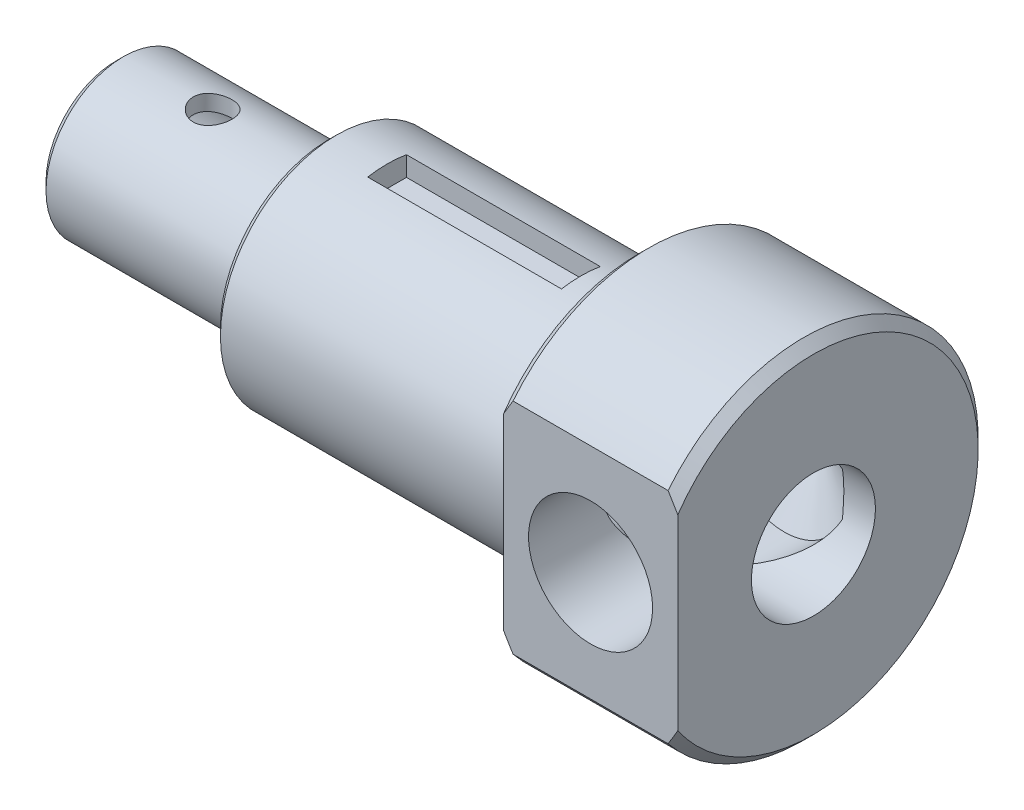
from build123d import *

# Parameters (mm, degrees)
CUT_EXTRUDE_9_DEPTH         = 191.91883092
CUT_EXTRUDE_9_DEPTH_BACK    = 191.91883092
SKETCH_6_W                  = 50
SKETCH_6_H                  = 5.5
CUT_EXTRUDE_4_DEPTH         = 5
CUT_EXTRUDE_10_DEPTH        = 191.91883092
CUT_EXTRUDE_10_DEPTH_BACK   = 191.91883092
SKETCH_16_R                 = 5
HOLE_WIZARD_0_15_32_1_D     = 32
HOLE_WIZARD_0_15_32_1_DEPTH = 50
HOLE_WIZARD_0_15_32_1_TIP   = 9.613769904
CHAMFER_3_SIZE              = 2
CHAMFER_4_SIZE              = 2.5
CHAMFER_5_SIZE              = 2


with BuildPart() as part:
    # Эскиз1 → Повернуть1 (revolve)
    with BuildSketch(Plane.XY, mode=Mode.PRIVATE) as revolve_1_sk:
        Polygon((0, 16), (0, 20), (55, 20), (55, 30), (135, 30), (135, 45), (180, 45), (180, 16), align=None)
    revolve(revolve_1_sk.sketch.rotate(Axis((0, 0, 0), (-1, 0, 0)), 90), axis=Axis((0, 0, 0), (-1, 0, 0)))

    # Эскиз15 → Вырез-Вытянуть9 (cut, two sides: drawn at the far end of the back side and taken through both)
    with BuildSketch(Plane(origin=(180, 0, 0), x_dir=(0, 0, -1), z_dir=(1, 0, 0)).offset(-CUT_EXTRUDE_9_DEPTH_BACK)):
        with BuildLine():
            Line((-35, -28.284271247), (-35, 28.284271247))
            ThreePointArc((-35, 28.284271247), (-45, 0), (-35, -28.284271247))
        make_face()
    extrude(amount=CUT_EXTRUDE_9_DEPTH + CUT_EXTRUDE_9_DEPTH_BACK, mode=Mode.SUBTRACT)

    # Эскиз6 → Вырез-Вытянуть4 (cut, symmetric)
    with BuildSketch(Plane.XY):
        with Locations((95, 27.25)):
            Rectangle(SKETCH_6_W, SKETCH_6_H)
    extrude(amount=CUT_EXTRUDE_4_DEPTH, both=True, mode=Mode.SUBTRACT)

    # Эскиз16 → Вырез-Вытянуть10 (cut, two sides: drawn at the far end of the back side and taken through both)
    with BuildSketch(Plane(origin=(0, 0, 0), x_dir=(1, 0, 0), z_dir=(0, 1, 0)).offset(-CUT_EXTRUDE_10_DEPTH_BACK)):
        with Locations(Location((25, 0, 0), (0, 0, 270))):
            Circle(SKETCH_16_R)
    extrude(amount=CUT_EXTRUDE_10_DEPTH + CUT_EXTRUDE_10_DEPTH_BACK, mode=Mode.SUBTRACT)

    # Диаметр отверстия Ø0.15 (32)1
    with Locations(Plane.XY.offset(35)):
        with Locations((157.5, 0)):
            Hole(HOLE_WIZARD_0_15_32_1_D / 2, depth=HOLE_WIZARD_0_15_32_1_DEPTH)
            with Locations((0, 0, -(HOLE_WIZARD_0_15_32_1_DEPTH + HOLE_WIZARD_0_15_32_1_TIP / 2))):  # 118° drill point
                Cone(0, HOLE_WIZARD_0_15_32_1_D / 2, HOLE_WIZARD_0_15_32_1_TIP, mode=Mode.SUBTRACT)

    # Фаска3
    chamfer_3_edges = [part.edges().sort_by_distance(p)[0] for p in [
        (0, 0, 16),
        (0, 0, 20),
    ]]
    chamfer(chamfer_3_edges, length=CHAMFER_3_SIZE - 0.0001)  # a hair under: the kernel refuses the full size

    # Фаска4
    chamfer_4_edges = [part.edges().sort_by_distance(p)[0] for p in [
        (180, 0, -45),
        (135, 0, -45),
    ]]
    chamfer(chamfer_4_edges, length=CHAMFER_4_SIZE)

    # Фаска5
    chamfer_5_edges = [part.edges().sort_by_distance(p)[0] for p in [
        (55, 0, 30),
    ]]
    chamfer(chamfer_5_edges, length=CHAMFER_5_SIZE)


solid = part.part
